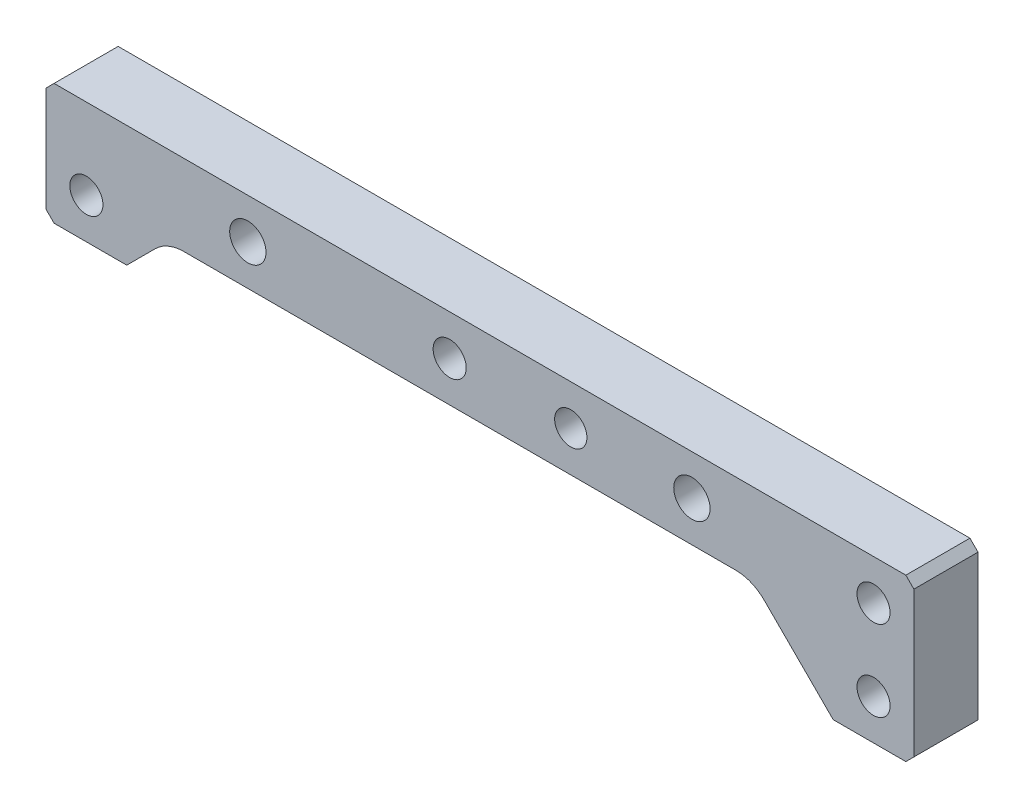
from build123d import *

# Parameters (mm, degrees)
SKETCH_1_R          = 4
SKETCH_1_R_2        = 4.1
EXTRUDE_1_DEPTH     = 15.875
CHAMFER_1_SIZE      = 2
SKETCH_2_R          = 4.5
CUT_EXTRUDE_1_DEPTH = 20
SKETCH_3_R          = 4.5
CUT_EXTRUDE_2_DEPTH = 20
CHAMFER_2_SIZE      = 20
CHAMFER_3_SIZE      = 10
FILLET_1_R          = 10


with BuildPart() as part:
    # 草图1 → 凸台-拉伸1 (new body)
    with BuildSketch(Plane.XY):
        Polygon((0, 10), (-130, 10), (-130, -20), (-110, -20), (-110, -10), (0, -10), (65, -10), (65, -30), (85, -30), (85, 10), align=None)
        Circle(SKETCH_1_R, mode=Mode.SUBTRACT)
        with Locations((-30, 0)):
            Circle(SKETCH_1_R_2, mode=Mode.SUBTRACT)
        with Locations((75, 0)):
            Circle(SKETCH_1_R_2, mode=Mode.SUBTRACT)
        with Locations((75, -20)):
            Circle(SKETCH_1_R_2, mode=Mode.SUBTRACT)
        with Locations((-120, -10)):
            Circle(SKETCH_1_R_2, mode=Mode.SUBTRACT)
    extrude(amount=EXTRUDE_1_DEPTH)

    # 倒角1
    chamfer_1_edges = [part.edges().sort_by_distance(p)[0] for p in [
        (-130, 10, 7.9375),
        (85, 10, 7.9375),
        (85, -30, 7.9375),
        (-130, -20, 7.9375),
    ]]
    chamfer(chamfer_1_edges, length=CHAMFER_1_SIZE)

    # 草图2 → 切除-拉伸1 (cut)
    with BuildSketch(Plane(origin=(0, 0, 0), x_dir=(-1, 0, 0), z_dir=(0, 0, -1))):
        with Locations((-30, 0)):
            Circle(SKETCH_2_R)
    extrude(amount=-CUT_EXTRUDE_1_DEPTH, mode=Mode.SUBTRACT)

    # 草图3 → 切除-拉伸2 (cut)
    with BuildSketch(Plane(origin=(0, 0, 0), x_dir=(-1, 0, 0), z_dir=(0, 0, -1))):
        with Locations((80, 0)):
            Circle(SKETCH_3_R)
    extrude(amount=-CUT_EXTRUDE_2_DEPTH, mode=Mode.SUBTRACT)

    # 倒角2
    chamfer_2_edges = [part.edges().sort_by_distance(p)[0] for p in [
        (65, -10, 7.9375),
    ]]
    chamfer(chamfer_2_edges, length=CHAMFER_2_SIZE - 0.0001)  # a hair under: the kernel refuses the full size

    # 倒角3
    chamfer_3_edges = [part.edges().sort_by_distance(p)[0] for p in [
        (-110, -10, 7.9375),
    ]]
    chamfer(chamfer_3_edges, length=CHAMFER_3_SIZE - 0.0001)  # a hair under: the kernel refuses the full size

    # 圆角1
    fillet_1_edges = [part.edges().sort_by_distance(p)[0] for p in [
        (45.0001, -10, 7.9375),
        (-100.0001, -10, 7.9375),
    ]]
    fillet(fillet_1_edges, radius=FILLET_1_R)


solid = part.part
